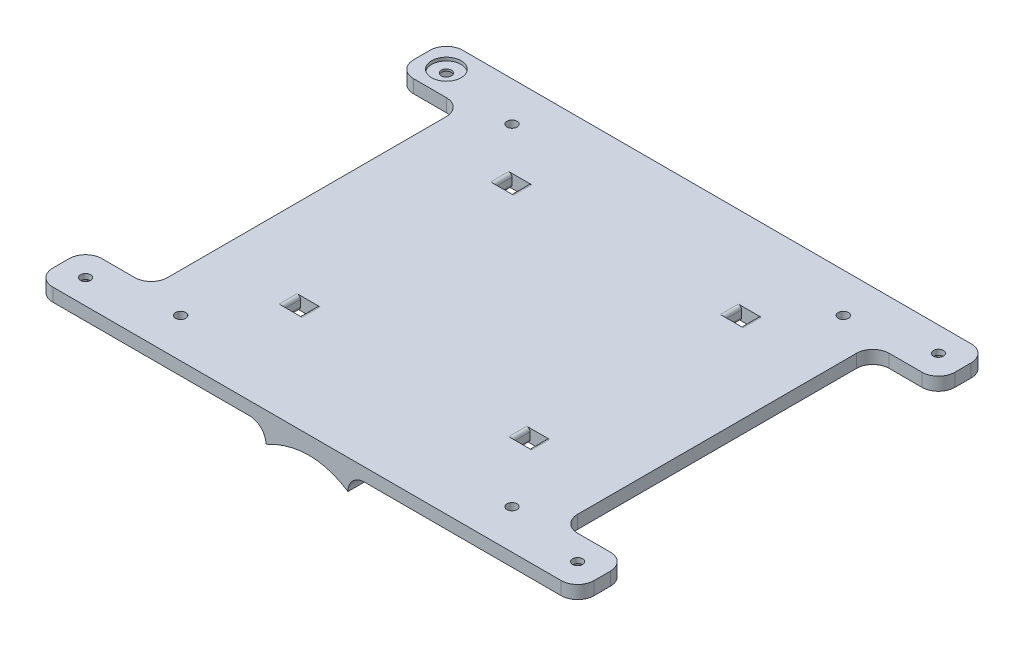
from build123d import *

# Parameters (mm, degrees)
BOSS_EXTRUDE1_DEPTH = 4
SKETCH2_R           = 1.55
CUT_EXTRUDE3_DEPTH  = 119.680122062
FILLET1_R           = 5
SKETCH5_R           = 1.525
CUT_EXTRUDE4_DEPTH  = 10
SKETCH5_3_R         = 4.5
CUT_EXTRUDE5_DEPTH  = 1
CUT_EXTRUDE6_DEPTH  = 2.4
SKETCH8_W           = 25
SKETCH8_H           = 125
BOSS_EXTRUDE4_DEPTH = 5
CUT_EXTRUDE7_DEPTH  = 160.724398205
FILLET5_R           = 5
SKETCH10_W          = 5
SKETCH10_H          = 5.5
CUT_EXTRUDE8_DEPTH  = 5
FILLET7_R           = 1


with BuildPart() as part:
    # Sketch1 → Boss-Extrude1 (new body)
    with BuildSketch(Plane(origin=(0, 0, 0), x_dir=(1, 0, 0), z_dir=(0, 1, 0))):
        Polygon((-79.307015775, 45.137931034), (-79.307015775, -49.862068966), (-99.307015775, -49.862068966), (-99.307015775, -64.862068966), (-68.307015775, -64.862068966), (45.692984225, -64.862068966), (65.692984225, -64.862068966), (65.692984225, -49.862068966), (45.692984225, -49.862068966), (45.692984225, 45.137931034), (65.692984225, 45.137931034), (65.692984225, 60.137931034), (45.692984225, 60.137931034), (-68.307015775, 60.137931034), (-99.307015775, 60.137931034), (-99.307015775, 45.137931034), align=None)
    extrude(amount=BOSS_EXTRUDE1_DEPTH)

    # Sketch2 → Cut-Extrude3 (cut, through all)
    with BuildSketch(Plane(origin=(0, 4, 0), x_dir=(1, 0, 0), z_dir=(0, 1, 0))):
        with Locations(Location((33.692984225, 48.137931034, 0), (0, 0, 270))):
            Circle(SKETCH2_R)
        with Locations(Location((-67.307015775, 48.137931034, 0), (0, 0, 270))):
            Circle(SKETCH2_R)
        with Locations(Location((-67.307015775, -52.862068966, 0), (0, 0, 270))):
            Circle(SKETCH2_R)
        with Locations(Location((33.692984225, -52.862068966, 0), (0, 0, 270))):
            Circle(SKETCH2_R)
    extrude(amount=-CUT_EXTRUDE3_DEPTH, mode=Mode.SUBTRACT)

    # Fillet1
    fillet1_edges = [part.edges().sort_by_distance(p)[0] for p in [
        (65.692984225, 2, -60.137931034),
        (65.692984225, 2, -45.137931034),
        (45.692984225, 2, -45.137931034),
        (45.692984225, 2, 49.862068966),
        (65.692984225, 2, 49.862068966),
        (65.692984225, 2, 64.862068966),
        (-99.307015775, 2, 64.862068966),
        (-99.307015775, 2, 49.862068966),
        (-79.307015775, 2, 49.862068966),
        (-79.307015775, 2, -45.137931034),
        (-99.307015775, 2, -45.137931034),
        (-99.307015775, 2, -60.137931034),
    ]]
    fillet(fillet1_edges, radius=FILLET1_R)

    # Sketch5 → Cut-Extrude4 (cut)
    with BuildSketch(Plane(origin=(0, 4, 0), x_dir=(1, 0, 0), z_dir=(0, 1, 0))):
        with Locations(Location((-91.807015775, 52.637931034, 0), (0, 0, 270))):
            Circle(SKETCH5_R)
        with Locations(Location((-91.807015775, -57.362068966, 0), (0, 0, 270))):
            Circle(SKETCH5_R)
        with Locations(Location((58.192984225, -57.362068966, 0), (0, 0, 270))):
            Circle(SKETCH5_R)
        with Locations(Location((58.192984225, 52.637931034, 0), (0, 0, 270))):
            Circle(SKETCH5_R)
    extrude(amount=-CUT_EXTRUDE4_DEPTH, mode=Mode.SUBTRACT)

    # Sketch5<3> → Cut-Extrude5 (cut)
    with BuildSketch(Plane(origin=(0, 4, 0), x_dir=(1, 0, 0), z_dir=(0, 1, 0))):
        with Locations(Location((-91.807015775, 52.637931034, 0), (0, 0, 270))):
            Circle(SKETCH5_3_R)
    extrude(amount=-CUT_EXTRUDE5_DEPTH, mode=Mode.SUBTRACT)

    # Sketch6 → Cut-Extrude6 (cut)
    with BuildSketch(Plane.XZ):
        Polygon((-88.636873981, 56.89548456), (-89.81787093, 59.87420009), (-92.988012724, 60.340784495), (-94.977157568, 57.828653371), (-93.79616062, 54.849937841), (-90.626018826, 54.383353436), align=None)
        Polygon((61.375334539, 56.987707532), (60.108365894, 59.930884464), (56.92601558, 60.305245897), (55.010633912, 57.736430399), (56.277602557, 54.793253467), (59.459952871, 54.418892034), align=None)
        Polygon((60.682419613, -50.620454529), (57.690516013, -49.473278495), (55.201080626, -51.490755001), (55.703548838, -54.65540754), (58.695452437, -55.802583574), (61.184887825, -53.785107068), align=None)
        Polygon((-88.740685409, -51.707813788), (-91.079355756, -49.517352419), (-94.145686121, -50.447469665), (-94.87334614, -53.568048281), (-92.534675794, -55.75850965), (-89.468345428, -54.828392404), align=None)
    extrude(amount=-CUT_EXTRUDE6_DEPTH, mode=Mode.SUBTRACT)

    # Sketch8 → Boss-Extrude4 (add)
    with BuildSketch(Plane.XZ):
        with Locations((-16.807015775, 2.362068966)):
            Rectangle(SKETCH8_W, SKETCH8_H)
    extrude(amount=BOSS_EXTRUDE4_DEPTH)

    # Sketch9 → Cut-Extrude7 (cut, through all)
    with BuildSketch(Plane.XY.offset(64.862068966)):
        with BuildLine():
            Line((-4.307015775, -5), (-29.307015775, -5))
            add(Edge.make_bspline(
                [(-4.307015775, -5), (-15.592681682, 2.270069745), (-29.307015775, -5)],
                knots=[0, 0, 0, 1, 1, 1], degree=2))
        make_face()
    extrude(amount=-CUT_EXTRUDE7_DEPTH, mode=Mode.SUBTRACT)

    # Fillet5
    fillet5_edges = [part.edges().sort_by_distance(p)[0] for p in [
        (-29.307015775, 0, 2.362068966),
        (-4.307015775, 0, 2.362068966),
    ]]
    fillet(fillet5_edges, radius=FILLET5_R - 0.0001)  # a hair under: the kernel refuses the full size

    # Sketch10 → Cut-Extrude8 (cut)
    with BuildSketch(Plane.XZ):
        with Locations((18.192984225, -32.387931034)):
            Rectangle(SKETCH10_W, SKETCH10_H)
        with Locations((18.192984225, 32.112068966)):
            Rectangle(SKETCH10_W, SKETCH10_H)
        with Locations((-51.807015775, 32.112068966)):
            Rectangle(SKETCH10_W, SKETCH10_H)
        with Locations((-51.807015775, -32.387931034)):
            Rectangle(SKETCH10_W, SKETCH10_H)
    extrude(amount=-CUT_EXTRUDE8_DEPTH, mode=Mode.SUBTRACT)

    # Fillet7
    fillet7_edges = [part.edges().sort_by_distance(p)[0] for p in [
        (20.692984225, 4, -32.387931034),
        (15.692984225, 4, -32.387931034),
        (20.692984225, 0, -32.387931034),
        (15.692984225, 0, -32.387931034),
        (-54.307015775, 4, -32.387931034),
        (-49.307015775, 4, -32.387931034),
        (-54.307015775, 4, 32.112068966),
        (-49.307015775, 4, 32.112068966),
        (20.692984225, 4, 32.112068966),
        (15.692984225, 4, 32.112068966),
        (20.692984225, 0, 32.112068966),
        (15.692984225, 0, 32.112068966),
        (-49.307015775, 0, 32.112068966),
        (-54.307015775, 0, 32.112068966),
        (-49.307015775, 0, -32.387931034),
        (-54.307015775, 0, -32.387931034),
    ]]
    fillet(fillet7_edges, radius=FILLET7_R)


solid = part.part
